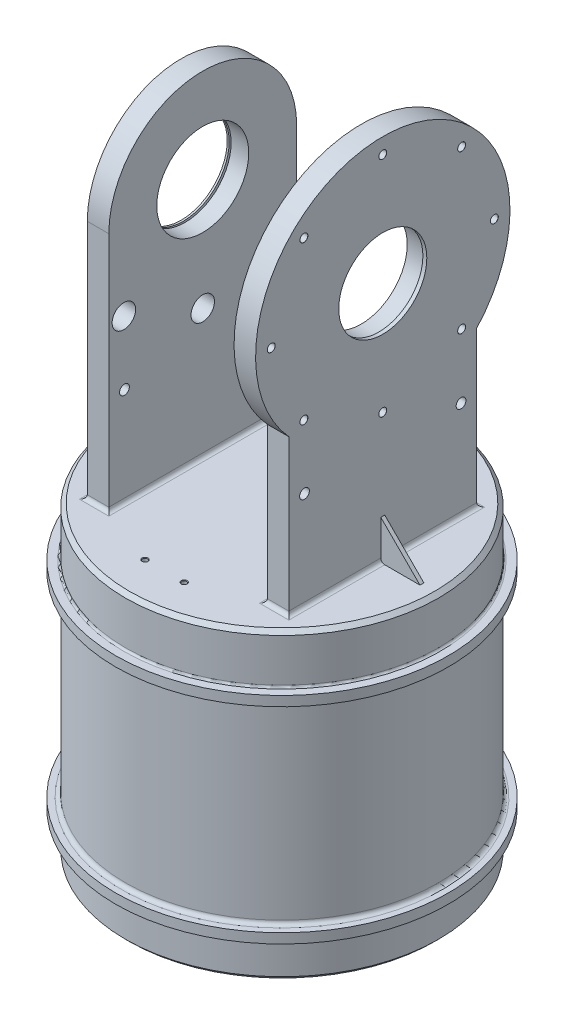
from build123d import *

# Parameters (mm, degrees)
SKETCH1_R                       = 85
SKETCH1_R_2                     = 80
SKETCH1_R_3                     = 75
BOSS_EXTRUDE1_DEPTH             = 150
SKETCH1_4_R                     = 80
SKETCH1_4_R_2                   = 75
CUT_EXTRUDE1_DEPTH              = 155
SKETCH2_R                       = 85
BOSS_EXTRUDE3_DEPTH             = 5
SKETCH2_3_W                     = 11
SKETCH2_3_H                     = 96
BOSS_EXTRUDE4_DEPTH             = 176
SKETCH2_4_W                     = 11
SKETCH2_4_H                     = 96
BOSS_EXTRUDE5_DEPTH             = 176
SKETCH3_R                       = 23.5
CUT_EXTRUDE3_DEPTH              = 90
CUT_EXTRUDE4_DEPTH              = 120
CUT_EXTRUDE5_DEPTH              = 20
CUT_EXTRUDE6_START              = -20
CUT_EXTRUDE6_DEPTH              = 20
SKETCH11_R                      = 2.5
CUT_EXTRUDE10_DEPTH             = 131
SKETCH1_7_R                     = 80
SKETCH1_7_R_2                   = 75
BOSS_EXTRUDE6_DEPTH             = 155
CUT_EXTRUDE12_DEPTH             = 20
CUT_EXTRUDE12_DEPTH_BACK        = 10
SKETCH1_10_R                    = 85
SKETCH1_10_R_2                  = 80
CUT_EXTRUDE13_START             = -25
SKETCH12_R                      = 85
SKETCH12_R_2                    = 80
CUT_EXTRUDE13_DEPTH             = 25
SKETCH1_11_R                    = 75
BOSS_EXTRUDE7_DEPTH             = 5
F_5_0MM_DOWEL_HOLE1_D           = 5
F_5_0MM_DOWEL_HOLE1_DEPTH       = 5
F_5_0MM_DOWEL_HOLE1_CSINK_D     = 5.05
F_5_0MM_DOWEL_HOLE1_CSINK_ANGLE = 90
F_5_0MM_DOWEL_HOLE1_TIP         = 1.502151548
BOSS_EXTRUDE8_DEPTH             = 2
SKETCH16_R                      = 25
CUT_EXTRUDE14_DEPTH             = 1
M3_TAPPED_HOLE1_D               = 2.5
M3_TAPPED_HOLE1_DEPTH           = 7.5
M3_TAPPED_HOLE1_CSINK_D         = 3.05
M3_TAPPED_HOLE1_CSINK_ANGLE     = 90
M3_TAPPED_HOLE1_TIP             = 0.751075774
SKETCH20_R                      = 65
SKETCH20_R_2                    = 23.5
BOSS_EXTRUDE9_DEPTH             = 11
CUT_EXTRUDE15_DEPTH             = 5
SKETCH26_R                      = 6
CUT_EXTRUDE16_DEPTH             = 15
CHAMFER1_SIZE                   = 2
FILLET1_R                       = 1
FILLET2_R                       = 1
CHAMFER2_SIZE                   = 2
SKETCH27_R                      = 85
SKETCH27_R_2                    = 80
CUT_EXTRUDE17_DEPTH             = 100
FILLET3_R                       = 2
RIB3_REACH                      = 365.454
SKETCH28_WALL_W                 = 757.19279369
SKETCH28_WALL_H                 = 2
RIB4_REACH                      = 365.454
SKETCH29_WALL_W                 = 757.19279369
SKETCH29_WALL_H                 = 2
FILLET4_R                       = 2


# Read off the part's stored shape, not the designer's step: Ø4.0mm Dowel Hole1
with BuildPart() as part:
    # Sketch1 → Boss-Extrude1 (new body)
    # profile 1 of 2: a face of its own
    with BuildSketch(Plane(origin=(0, 0, 0), x_dir=(1, 0, 0), z_dir=(0, 1, 0))):
        with Locations(Location((0, 0, 0), (0, 0, 270))):
            Circle(SKETCH1_R)
        Circle(SKETCH1_R_2, mode=Mode.SUBTRACT)
    # profile 2 of 2: a face of its own
    with BuildSketch(Plane(origin=(0, 0, 0), x_dir=(1, 0, 0), z_dir=(0, 1, 0))):
        Circle(SKETCH1_R_2)
        with Locations(Location((0, 0, 0), (0, 0, 270))):
            Circle(SKETCH1_R_3, mode=Mode.SUBTRACT)
    extrude(amount=BOSS_EXTRUDE1_DEPTH)

    # Sketch1<4> → Cut-Extrude1 (cut)
    with BuildSketch(Plane(origin=(0, 0, 0), x_dir=(1, 0, 0), z_dir=(0, 1, 0))):
        with Locations(Location((0, 0, 0), (0, 0, 270))):
            Circle(SKETCH1_4_R)
        Circle(SKETCH1_4_R_2, mode=Mode.SUBTRACT)
    extrude(amount=CUT_EXTRUDE1_DEPTH, mode=Mode.SUBTRACT)

    # Sketch2 → Boss-Extrude3 (add)
    with BuildSketch(Plane(origin=(0, 150, 0), x_dir=(1, 0, 0), z_dir=(0, 1, 0))):
        with Locations(Location((0, 0, 0), (0, 0, 270))):
            Circle(SKETCH2_R)
    extrude(amount=BOSS_EXTRUDE3_DEPTH)

    # Sketch2<3> → Boss-Extrude4 (add)
    with BuildSketch(Plane(origin=(0, 150, 0), x_dir=(1, 0, 0), z_dir=(0, 1, 0))):
        with Locations((46, 0)):
            Rectangle(SKETCH2_3_W, SKETCH2_3_H)
    extrude(amount=BOSS_EXTRUDE4_DEPTH)

    # Sketch2<4> → Boss-Extrude5 (add)
    with BuildSketch(Plane(origin=(0, 150, 0), x_dir=(1, 0, 0), z_dir=(0, 1, 0))):
        with Locations((-46, 0)):
            Rectangle(SKETCH2_4_W, SKETCH2_4_H)
    extrude(amount=BOSS_EXTRUDE5_DEPTH)

    # Sketch3 → Cut-Extrude3 (cut)
    with BuildSketch(Plane(origin=(51.5, 0, 0), x_dir=(0, 0, -1), z_dir=(1, 0, 0))):
        with Locations((0, 278)):
            Circle(SKETCH3_R)
    extrude(amount=-CUT_EXTRUDE3_DEPTH, mode=Mode.SUBTRACT)

    # Sketch3<3> → Cut-Extrude4 (cut)
    with BuildSketch(Plane(origin=(51.5, 0, 0), x_dir=(0, 0, -1), z_dir=(1, 0, 0))):
        with BuildLine():
            ThreePointArc((0, 300.5), (-22.5, 278), (0, 255.5))
            Line((0, 255.5), (0, 300.5))
        make_face()
        with BuildLine():
            Line((0, 300.5), (0, 255.5))
            ThreePointArc((0, 255.5), (15.909902577, 262.090097423), (22.5, 278))
            ThreePointArc((22.5, 278), (15.909902577, 293.909902577), (0, 300.5))
        make_face()
        with BuildLine():
            ThreePointArc((0, 301.5), (-23.5, 278), (0, 254.5))
            Line((0, 254.5), (0, 255.5))
            ThreePointArc((0, 255.5), (-22.5, 278), (0, 300.5))
            Line((0, 300.5), (0, 301.5))
        make_face()
        with BuildLine():
            Line((0, 255.5), (0, 254.5))
            ThreePointArc((0, 254.5), (16.617009358, 261.382990642), (23.5, 278))
            ThreePointArc((23.5, 278), (16.617009358, 294.617009358), (0, 301.5))
            Line((0, 301.5), (0, 300.5))
            ThreePointArc((0, 300.5), (15.909902577, 293.909902577), (22.5, 278))
            ThreePointArc((22.5, 278), (15.909902577, 262.090097423), (0, 255.5))
        make_face()
    extrude(amount=-CUT_EXTRUDE4_DEPTH, mode=Mode.SUBTRACT)

    # Sketch4 → Cut-Extrude5 (cut)
    with BuildSketch(Plane(origin=(51.5, 0, 0), x_dir=(0, 0, -1), z_dir=(1, 0, 0))):
        with BuildLine():
            Line((-48, 326), (-48, 278))
            ThreePointArc((-48, 278), (-33.941125268, 311.941125726), (6.48e-07, 326))
            Line((6.48e-07, 326), (-48, 326))
        make_face()
        with BuildLine():
            ThreePointArc((6.48e-07, 326), (33.941125726, 311.941125268), (48, 278))
            Line((48, 278), (48, 326))
            Line((48, 326), (6.48e-07, 326))
        make_face()
    extrude(amount=-CUT_EXTRUDE5_DEPTH, mode=Mode.SUBTRACT)

    # Sketch5 → Cut-Extrude6 (cut)
    with BuildSketch(Plane.ZY.offset(51.5).offset(CUT_EXTRUDE6_START)):
        with BuildLine():
            Line((-48, 326), (-48, 278))
            ThreePointArc((-48, 278), (-33.941125497, 311.941125497), (0, 326))
            Line((0, 326), (-48, 326))
        make_face()
        with BuildLine():
            ThreePointArc((0, 326), (33.941125497, 311.941125497), (48, 278))
            Line((48, 278), (48, 326))
            Line((48, 326), (0, 326))
        make_face()
    extrude(amount=CUT_EXTRUDE6_DEPTH, mode=Mode.SUBTRACT)

    # Sketch11 → Cut-Extrude10 (cut)
    with BuildSketch(Plane(origin=(51.5, 0, 0), x_dir=(0, 0, -1), z_dir=(1, 0, 0))):
        with Locations((-40, 205)):
            Circle(SKETCH11_R)
        with Locations((40, 205)):
            Circle(SKETCH11_R)
    extrude(amount=-CUT_EXTRUDE10_DEPTH, mode=Mode.SUBTRACT)

    # Sketch1<7> → Boss-Extrude6 (add)
    with BuildSketch(Plane(origin=(0, 0, 0), x_dir=(1, 0, 0), z_dir=(0, 1, 0))):
        Circle(SKETCH1_7_R)
        with Locations(Location((0, 0, 0), (0, 0, 270))):
            Circle(SKETCH1_7_R_2, mode=Mode.SUBTRACT)
    extrude(amount=BOSS_EXTRUDE6_DEPTH)

    # Sketch1<10> → Cut-Extrude12 (cut, two sides: drawn at the far end of the back side and taken through both)
    with BuildSketch(Plane(origin=(0, 0, 0), x_dir=(1, 0, 0), z_dir=(0, 1, 0)).offset(-CUT_EXTRUDE12_DEPTH_BACK)):
        with Locations(Location((0, 0, 0), (0, 0, 270))):
            Circle(SKETCH1_10_R)
        with Locations(Location((0, 0, 0), (0, 0, 270))):
            Circle(SKETCH1_10_R_2, mode=Mode.SUBTRACT)
    extrude(amount=CUT_EXTRUDE12_DEPTH + CUT_EXTRUDE12_DEPTH_BACK, mode=Mode.SUBTRACT)

    # Sketch12 → Cut-Extrude13 (cut)
    with BuildSketch(Plane(origin=(0, 155, 0), x_dir=(1, 0, 0), z_dir=(0, 1, 0)).offset(CUT_EXTRUDE13_START)):
        with Locations(Location((0, 0, 0), (0, 0, 270))):
            Circle(SKETCH12_R)
        with Locations(Location((0, 0, 0), (0, 0, 270))):
            Circle(SKETCH12_R_2, mode=Mode.SUBTRACT)
    extrude(amount=CUT_EXTRUDE13_DEPTH, mode=Mode.SUBTRACT)

    # Sketch1<11> → Boss-Extrude7 (add)
    with BuildSketch(Plane(origin=(0, 0, 0), x_dir=(1, 0, 0), z_dir=(0, 1, 0))):
        with Locations(Location((0, 0, 0), (0, 0, 270))):
            Circle(SKETCH1_11_R)
    extrude(amount=BOSS_EXTRUDE7_DEPTH)

    # Ø5.0mm Dowel Hole1
    with Locations(Plane(origin=(0, 0, 0), x_dir=(-1, 0, 0), z_dir=(0, -1, 0))):
        with Locations((12.340862004, 7.125), (-12.340862004, 7.125), (0, -14.25)):
            CounterSinkHole(F_5_0MM_DOWEL_HOLE1_D / 2, F_5_0MM_DOWEL_HOLE1_CSINK_D / 2, depth=F_5_0MM_DOWEL_HOLE1_DEPTH, counter_sink_angle=F_5_0MM_DOWEL_HOLE1_CSINK_ANGLE)
            with Locations((0, 0, -(F_5_0MM_DOWEL_HOLE1_DEPTH + F_5_0MM_DOWEL_HOLE1_TIP / 2))):  # 118° drill point
                Cone(0, F_5_0MM_DOWEL_HOLE1_D / 2, F_5_0MM_DOWEL_HOLE1_TIP, mode=Mode.SUBTRACT)

    # Sketch3<4> → Boss-Extrude8 (add)
    with BuildSketch(Plane(origin=(51.5, 0, 0), x_dir=(0, 0, -1), z_dir=(1, 0, 0))):
        with BuildLine():
            ThreePointArc((0, 301.5), (-23.5, 278), (0, 254.5))
            Line((0, 254.5), (0, 255.5))
            ThreePointArc((0, 255.5), (-22.5, 278), (0, 300.5))
            Line((0, 300.5), (0, 301.5))
        make_face()
        with BuildLine():
            Line((0, 255.5), (0, 254.5))
            ThreePointArc((0, 254.5), (16.617009358, 261.382990642), (23.5, 278))
            ThreePointArc((23.5, 278), (16.617009358, 294.617009358), (0, 301.5))
            Line((0, 301.5), (0, 300.5))
            ThreePointArc((0, 300.5), (15.909902577, 293.909902577), (22.5, 278))
            ThreePointArc((22.5, 278), (15.909902577, 262.090097423), (0, 255.5))
        make_face()
    extrude(amount=-BOSS_EXTRUDE8_DEPTH)

    # Sketch16 → Cut-Extrude14 (cut)
    with BuildSketch(Plane.ZY.offset(49.5)):
        with Locations((0, 278)):
            Circle(SKETCH16_R)
    extrude(amount=CUT_EXTRUDE14_DEPTH, mode=Mode.SUBTRACT)

    # M3 Tapped Hole1
    with Locations(Plane(origin=(0, 155, 0), x_dir=(1, 0, 0), z_dir=(0, 1, 0))):
        with Locations((10, -60), (-10, -60), (10, 60), (-10, 60)):
            CounterSinkHole(M3_TAPPED_HOLE1_D / 2, M3_TAPPED_HOLE1_CSINK_D / 2, depth=M3_TAPPED_HOLE1_DEPTH, counter_sink_angle=M3_TAPPED_HOLE1_CSINK_ANGLE)
            with Locations((0, 0, -(M3_TAPPED_HOLE1_DEPTH + M3_TAPPED_HOLE1_TIP / 2))):  # 118° drill point
                Cone(0, M3_TAPPED_HOLE1_D / 2, M3_TAPPED_HOLE1_TIP, mode=Mode.SUBTRACT)

    # Sketch20 → Boss-Extrude9 (add)
    with BuildSketch(Plane(origin=(51.5, 0, 0), x_dir=(0, 0, -1), z_dir=(1, 0, 0))):
        with Locations((0, 278)):
            Circle(SKETCH20_R)
        with Locations((0, 278)):
            Circle(SKETCH20_R_2, mode=Mode.SUBTRACT)
    extrude(amount=-BOSS_EXTRUDE9_DEPTH)

    # Ø4.0mm Dowel Hole1 outline → Ø4.0mm Dowel Hole1 (revolve, cut)
    with BuildSketch(Plane(origin=(0, 318.305086528, 40.305086528), x_dir=(0, 1, 0), z_dir=(0, 0, -1))):
        Polygon((0, 40.5), (2, 40.5), (2, 51.475), (2.025, 51.5), (0, 51.5), align=None)
    revolve(axis=Axis((0, 318.305086528, 40.305086528), (1, 0, 0)), mode=Mode.SUBTRACT)

    # 4.0mm Dowel Hole1 2 outline → 4.0mm Dowel Hole1 2 (revolve, cut)
    with BuildSketch(Plane(origin=(0, 278, 57), x_dir=(0, 1, 0), z_dir=(0, 0, -1))):
        Polygon((0, 40.5), (2, 40.5), (2, 51.475), (2.025, 51.5), (0, 51.5), align=None)
    revolve(axis=Axis((0, 278, 57), (1, 0, 0)), mode=Mode.SUBTRACT)

    # 4.0mm Dowel Hole1 3 outline → 4.0mm Dowel Hole1 3 (revolve, cut)
    with BuildSketch(Plane(origin=(0, 237.694913472, 40.305086528), x_dir=(0, 1, 0), z_dir=(0, 0, -1))):
        Polygon((0, 40.5), (2, 40.5), (2, 51.475), (2.025, 51.5), (0, 51.5), align=None)
    revolve(axis=Axis((0, 237.694913472, 40.305086528), (1, 0, 0)), mode=Mode.SUBTRACT)

    # 4.0mm Dowel Hole1 4 outline → 4.0mm Dowel Hole1 4 (revolve, cut)
    with BuildSketch(Plane(origin=(0, 221, 0), x_dir=(0, 1, 0), z_dir=(0, 0, -1))):
        Polygon((0, 40.5), (2, 40.5), (2, 51.475), (2.025, 51.5), (0, 51.5), align=None)
    revolve(axis=Axis((0, 221, 0), (1, 0, 0)), mode=Mode.SUBTRACT)

    # 4.0mm Dowel Hole1 5 outline → 4.0mm Dowel Hole1 5 (revolve, cut)
    with BuildSketch(Plane(origin=(0, 237.694913472, -40.305086528), x_dir=(0, 1, 0), z_dir=(0, 0, -1))):
        Polygon((0, 40.5), (2, 40.5), (2, 51.475), (2.025, 51.5), (0, 51.5), align=None)
    revolve(axis=Axis((0, 237.694913472, -40.305086528), (1, 0, 0)), mode=Mode.SUBTRACT)

    # 4.0mm Dowel Hole1 6 outline → 4.0mm Dowel Hole1 6 (revolve, cut)
    with BuildSketch(Plane(origin=(0, 278, -57), x_dir=(0, 1, 0), z_dir=(0, 0, -1))):
        Polygon((0, 40.5), (2, 40.5), (2, 51.475), (2.025, 51.5), (0, 51.5), align=None)
    revolve(axis=Axis((0, 278, -57), (1, 0, 0)), mode=Mode.SUBTRACT)

    # 4.0mm Dowel Hole1 7 outline → 4.0mm Dowel Hole1 7 (revolve, cut)
    with BuildSketch(Plane(origin=(0, 318.305086528, -40.305086528), x_dir=(0, 1, 0), z_dir=(0, 0, -1))):
        Polygon((0, 40.5), (2, 40.5), (2, 51.475), (2.025, 51.5), (0, 51.5), align=None)
    revolve(axis=Axis((0, 318.305086528, -40.305086528), (1, 0, 0)), mode=Mode.SUBTRACT)

    # 4.0mm Dowel Hole1 8 outline → 4.0mm Dowel Hole1 8 (revolve, cut)
    with BuildSketch(Plane(origin=(0, 335, 0), x_dir=(0, 1, 0), z_dir=(0, 0, -1))):
        Polygon((0, 40.5), (2, 40.5), (2, 51.475), (2.025, 51.5), (0, 51.5), align=None)
    revolve(axis=Axis((0, 335, 0), (1, 0, 0)), mode=Mode.SUBTRACT)

    # Sketch21 → Cut-Extrude15 (cut)
    with BuildSketch(Plane.ZY.offset(-40.5)):
        Polygon((43.366948706, 321.366948706), (39.184367187, 322.487668046), (36.122505009, 319.425805868), (37.243224349, 315.243224349), (41.425805868, 314.122505009), (44.487668046, 317.184367187), align=None)
        Polygon((0, 339.330127019), (-3.75, 337.165063509), (-3.75, 332.834936491), (0, 330.669872981), (3.75, 332.834936491), (3.75, 337.165063509), align=None)
        Polygon((61.330127019, 278), (59.165063509, 281.75), (54.834936491, 281.75), (52.669872981, 278), (54.834936491, 274.25), (59.165063509, 274.25), align=None)
        Polygon((43.366948706, 234.633051294), (44.487668046, 238.815632813), (41.425805868, 241.877494991), (37.243224349, 240.756775651), (36.122505009, 236.574194132), (39.184367187, 233.512331954), align=None)
        Polygon((0, 216.669872981), (3.75, 218.834936491), (3.75, 223.165063509), (0, 225.330127019), (-3.75, 223.165063509), (-3.75, 218.834936491), align=None)
        Polygon((-43.366948706, 234.633051294), (-39.184367187, 233.512331954), (-36.122505009, 236.574194132), (-37.243224349, 240.756775651), (-41.425805868, 241.877494991), (-44.487668046, 238.815632813), align=None)
        Polygon((-61.330127019, 278), (-59.165063509, 274.25), (-54.834936491, 274.25), (-52.669872981, 278), (-54.834936491, 281.75), (-59.165063509, 281.75), align=None)
        Polygon((-43.366948706, 321.366948706), (-44.487668046, 317.184367187), (-41.425805868, 314.122505009), (-37.243224349, 315.243224349), (-36.122505009, 319.425805868), (-39.184367187, 322.487668046), align=None)
    extrude(amount=-CUT_EXTRUDE15_DEPTH, mode=Mode.SUBTRACT)

    # Sketch26 → Cut-Extrude16 (cut)
    # profile 1 of 6: a face of its own
    with BuildSketch(Plane.ZY.offset(51.5)):
        with Locations((-40.305086528, 237.694913472)):
            Circle(SKETCH26_R)
        Polygon((-44.487668046, 238.815632813), (-43.366948706, 234.633051294), (-39.184367187, 233.512331954), (-36.122505009, 236.574194132), (-37.243224349, 240.756775651), (-41.425805868, 241.877494991), align=None, mode=Mode.SUBTRACT)
    # profile 2 of 6: a face of its own
    with BuildSketch(Plane.ZY.offset(51.5)):
        Polygon((-41.425805868, 241.877494991), (-44.487668046, 238.815632813), (-43.366948706, 234.633051294), (-39.184367187, 233.512331954), (-36.122505009, 236.574194132), (-37.243224349, 240.756775651), align=None)
    # profile 3 of 6: a face of its own
    with BuildSketch(Plane.ZY.offset(51.5)):
        with Locations((0, 221)):
            Circle(SKETCH26_R)
        Polygon((-3.75, 218.834936491), (0, 216.669872981), (3.75, 218.834936491), (3.75, 223.165063509), (0, 225.330127019), (-3.75, 223.165063509), align=None, mode=Mode.SUBTRACT)
    # profile 4 of 6: a face of its own
    with BuildSketch(Plane.ZY.offset(51.5)):
        Polygon((-3.75, 223.165063509), (-3.75, 218.834936491), (0, 216.669872981), (3.75, 218.834936491), (3.75, 223.165063509), (0, 225.330127019), align=None)
    # profile 5 of 6: a face of its own
    with BuildSketch(Plane.ZY.offset(51.5)):
        with Locations((40.305086528, 237.694913472)):
            Circle(SKETCH26_R)
        Polygon((39.184367187, 233.512331954), (43.366948706, 234.633051294), (44.487668046, 238.815632813), (41.425805868, 241.877494991), (37.243224349, 240.756775651), (36.122505009, 236.574194132), align=None, mode=Mode.SUBTRACT)
    # profile 6 of 6: a face of its own
    with BuildSketch(Plane.ZY.offset(51.5)):
        Polygon((36.122505009, 236.574194132), (39.184367187, 233.512331954), (43.366948706, 234.633051294), (44.487668046, 238.815632813), (41.425805868, 241.877494991), (37.243224349, 240.756775651), align=None)
    extrude(amount=-CUT_EXTRUDE16_DEPTH, mode=Mode.SUBTRACT)

    # Chamfer1
    chamfer1_edges = [part.edges().sort_by_distance(p)[0] for p in [
        (0, 155, -80),
    ]]
    chamfer(chamfer1_edges, length=CHAMFER1_SIZE)

    # Fillet1
    fillet1_edges = [part.edges().sort_by_distance(p)[0] for p in [
        (0, 130, -80),
    ]]
    fillet(fillet1_edges, radius=FILLET1_R)

    # Fillet2
    fillet2_edges = [part.edges().sort_by_distance(p)[0] for p in [
        (0, 20, -80),
    ]]
    fillet(fillet2_edges, radius=FILLET2_R)

    # Chamfer2
    chamfer2_edges = [part.edges().sort_by_distance(p)[0] for p in [
        (0, 0, -80),
    ]]
    chamfer(chamfer2_edges, length=CHAMFER2_SIZE)

    # Sketch27 → Cut-Extrude17 (cut)
    with BuildSketch(Plane(origin=(0, 25, 0), x_dir=(-1, 0, 0), z_dir=(0, -1, 0))):
        with Locations(Location((0, 0, 0), (0, 0, 90))):
            Circle(SKETCH27_R)
        with Locations(Location((0, 0, 0), (0, 0, 270))):
            Circle(SKETCH27_R_2, mode=Mode.SUBTRACT)
    extrude(amount=-CUT_EXTRUDE17_DEPTH, mode=Mode.SUBTRACT)

    # Fillet3
    fillet3_edges = [part.edges().sort_by_distance(p)[0] for p in [
        (46, 155, 48),
        (40.5, 155, 0),
        (46, 155, -48),
        (51.5, 155, 0),
        (-46, 155, 48),
        (-51.5, 155, 0),
        (-46, 155, -48),
        (-40.5, 155, 0),
    ]]
    fillet(fillet3_edges, radius=FILLET3_R)

    # Sketch28 wall → Rib3 (add, up to next)
    with BuildSketch(Plane(origin=(-61.5, 165, 0), x_dir=(-0.707106781187, -0.707106781187, 0), z_dir=(-0.707106781187, 0.707106781187, 0)), mode=Mode.PRIVATE) as rib3_sk1:
        Rectangle(SKETCH28_WALL_W, SKETCH28_WALL_H)
    rib3_tool1 = extrude(rib3_sk1.sketch, amount=-RIB3_REACH, mode=Mode.PRIVATE) - part.part
    add(rib3_tool1.solids().sort_by_distance((-61.5, 165, 0))[0])

    # Sketch29 wall → Rib4 (add, up to next)
    with BuildSketch(Plane(origin=(61.5, 165, 0), x_dir=(0.707106781187, -0.707106781187, 0), z_dir=(-0.707106781187, -0.707106781187, 0)), mode=Mode.PRIVATE) as rib4_sk1:
        Rectangle(SKETCH29_WALL_W, SKETCH29_WALL_H)
    rib4_tool1 = extrude(rib4_sk1.sketch, amount=RIB4_REACH, mode=Mode.PRIVATE) - part.part
    add(rib4_tool1.solids().sort_by_distance((61.5, 165, 0))[0])

    # Fillet4
    fillet4_edges = [part.edges().sort_by_distance(p)[0] for p in [
        (0, 125, -80),
        (0, 25, -80),
    ]]
    fillet(fillet4_edges, radius=FILLET4_R)


solid = part.part
